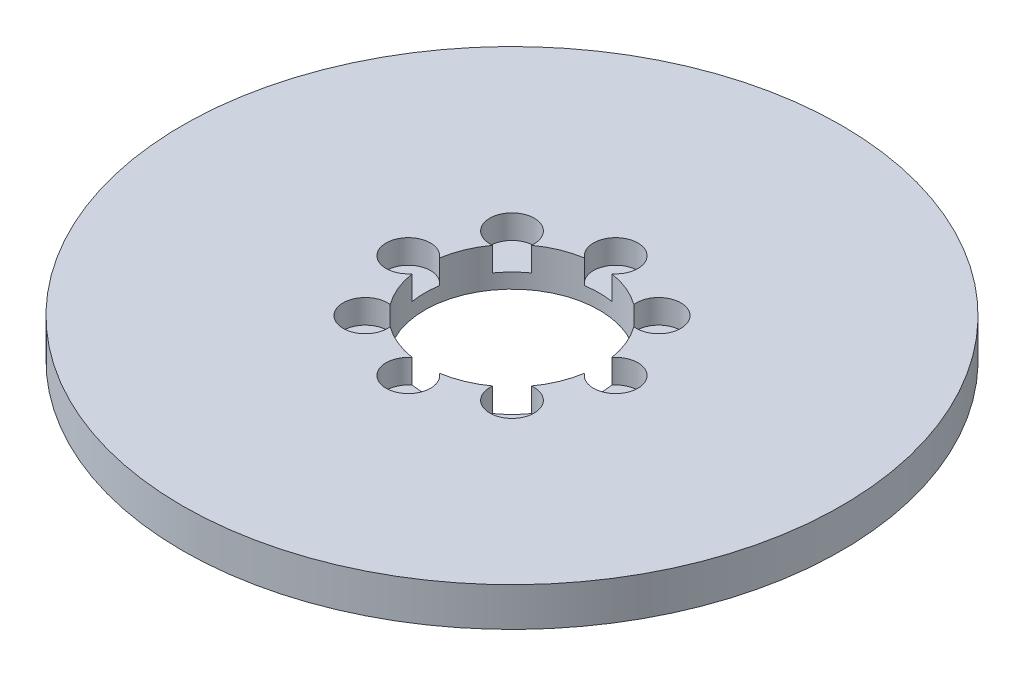
from build123d import *

# Parameters (mm, degrees)
SKETCH1_R           = 85
BOSS_EXTRUDE1_DEPTH = 10
SKETCH2_R           = 22.5
CUT_EXTRUDE1_DEPTH  = 121.623380818
SKETCH3_R           = 5.725933594
CUT_EXTRUDE2_DEPTH  = 6.17025963
CIRPATTERN1_COUNT   = 8


with BuildPart() as part:
    # Sketch1 → Boss-Extrude1 (new body)
    with BuildSketch(Plane(origin=(0, 0, 0), x_dir=(1, 0, 0), z_dir=(0, 1, 0))):
        Circle(SKETCH1_R)
    extrude(amount=BOSS_EXTRUDE1_DEPTH)

    # Sketch2 → Cut-Extrude1 (cut, through all)
    with BuildSketch(Plane(origin=(0, 0, 0), x_dir=(1, 0, 0), z_dir=(0, 1, 0))):
        Circle(SKETCH2_R)
    extrude(amount=CUT_EXTRUDE1_DEPTH, mode=Mode.SUBTRACT)

    # Sketch3 → Cut-Extrude2 (cut)
    with BuildSketch(Plane(origin=(0, 10, 0), x_dir=(1, 0, 0), z_dir=(0, 1, 0))):
        with Locations((-26.74451963, 0)):
            Circle(SKETCH3_R)
    cut_extrude2 = extrude(amount=-CUT_EXTRUDE2_DEPTH, mode=Mode.SUBTRACT)

    # CirPattern1: Cut-Extrude2 ×8 about axis
    cirpattern1_axis = Axis((0, 0, 0), (0, 1, 0))
    for i in range(1, CIRPATTERN1_COUNT):
        add(cut_extrude2.rotate(cirpattern1_axis, i * 360 / CIRPATTERN1_COUNT), mode=Mode.SUBTRACT)


solid = part.part
